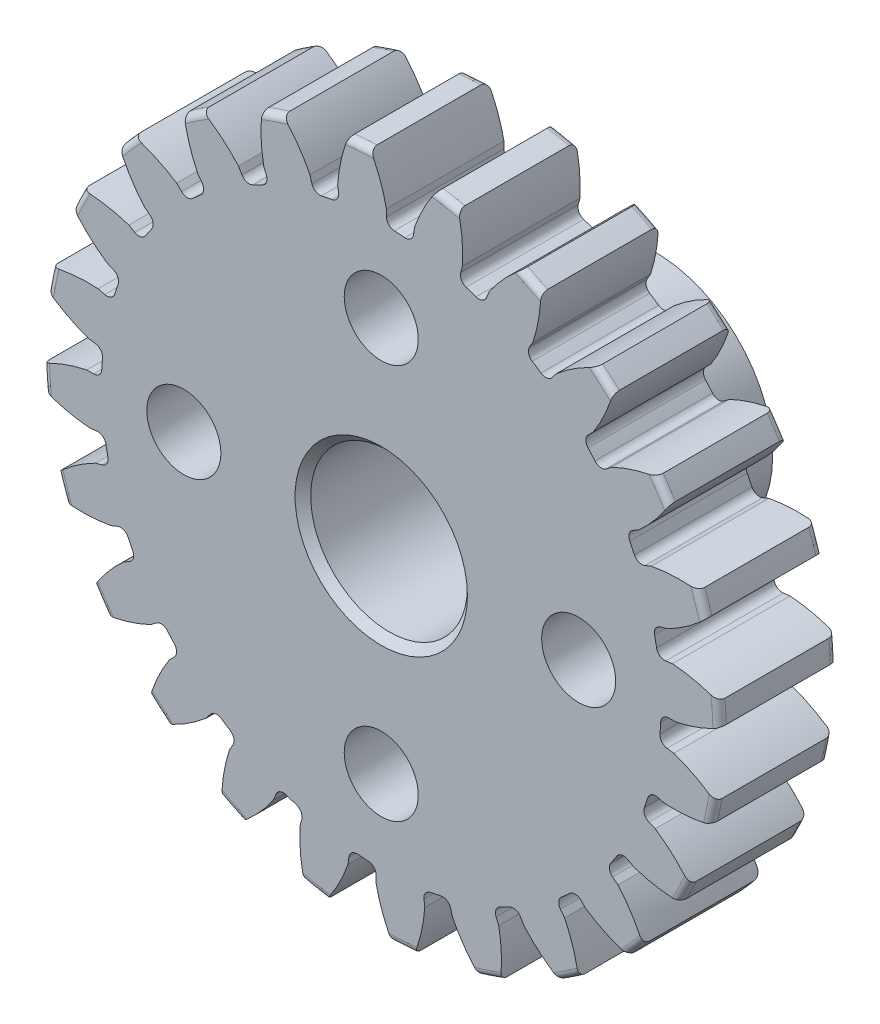
from build123d import *

# Parameters (mm, degrees)
SKETCH1_R                = 13.716
BOSS_EXTRUDE1_DEPTH      = 4.7625
SKETCH2_W                = 6.3373
SKETCH2_H                = 6.35
FILLET2_R                = 0.27432
CUT_EXTRUDE1_DEPTH       = 23.348666063
FILLET1_R                = 0.332486
CIRPATTERN1_COUNT        = 24
FILLET1_OF_CIRPATTERN1_R = 0.332486
SKETCH5_R                = 3.175
CUT_EXTRUDE2_DEPTH       = 23.339624524
CHAMFER1_SIZE            = 0.3175
SKETCH19_OUTSIDE_W       = 37.484
SKETCH19_OUTSIDE_H       = 37.484
SKETCH19_OUTSIDE_R       = 4.7625
CUT_EXTRUDE9_DEPTH       = 21.396436825
SKETCH20_R               = 1.5
CUT_EXTRUDE8_DEPTH       = 21.396436825
CHAMFER4_SIZE            = 1.5
CUT_EXTRUDE10_DEPTH      = 23.339624524
CUT_EXTRUDE10_DEPTH_BACK = 23.339624524
SKETCH21_R               = 0.9525


with BuildPart() as part:
    # Sketch1 → Boss-Extrude1 (new body)
    with BuildSketch(Plane.XY):
        Circle(SKETCH1_R)
    extrude(amount=-BOSS_EXTRUDE1_DEPTH)

    # Sketch2 → Revolve1 (revolve)
    with BuildSketch(Plane(origin=(0, 0, 0), x_dir=(0, 0, -1), z_dir=(1, 0, 0))):
        with Locations((7.93115, 3.175)):
            Rectangle(SKETCH2_W, SKETCH2_H)
    revolve(axis=Axis((0, 0, -4.7625), (0, 0, -1)))

    # Fillet2
    fillet2_edges = [part.edges().sort_by_distance(p)[0] for p in [
        (-13.716, 0, -4.7625),
        (-13.716, 0, 0),
        (0, -6.35, -4.7625),
    ]]
    fillet(fillet2_edges, radius=FILLET2_R)

    # Sketch4 → Cut-Extrude1 (cut, through all)
    with BuildSketch(Plane.XY):
        with BuildLine():
            Line((0.210191388, 11.932245124), (0.210191388, 11.33280094))
            ThreePointArc((0.210191388, 11.33280094), (0.74132985, 11.310481317), (1.27083763, 11.263282349))
            Line((1.27083763, 11.263282349), (1.349080978, 11.857598181))
            add(Edge.make_bspline(
                [(5.307200939, 15.849419331), (2.291771979, 14.546050899), (1.349080978, 11.857598181)],
                knots=[0, 0, 0, 1, 1, 1], degree=2))
            ThreePointArc((5.307200939, 15.849419331), (1.093175261, 16.67859235), (-3.193027723, 16.406555059))
            add(Edge.make_bspline(
                [(-3.193027723, 16.406555059), (-0.37352041, 14.720743801), (0.210191388, 11.932245124)],
                knots=[0, 0, 0, 1, 1, 1], degree=2))
        make_face()
    cut_extrude1 = extrude(amount=-CUT_EXTRUDE1_DEPTH, mode=Mode.SUBTRACT)

    # Fillet1
    fillet1_edges = [part.edges().sort_by_distance(p)[0] for p in [
        (1.27083763, 11.263282349, -2.38125),
        (0.210191388, 11.33280094, -2.38125),
    ]]
    fillet(fillet1_edges, radius=FILLET1_R)

    # CirPattern1: Cut-Extrude1 ×24 about axis
    cirpattern1_axis = Axis((0, 0, -4.7625), (0, 0, 1))
    for i in range(1, CIRPATTERN1_COUNT):
        add(cut_extrude1.rotate(cirpattern1_axis, i * 360 / CIRPATTERN1_COUNT), mode=Mode.SUBTRACT)

    # Fillet1 of CirPattern1
    fillet1_of_cirpattern1_edges = [part.edges().sort_by_distance(p)[0] for p in [
        (-1.687617095, 11.208412292, -2.38125),
        (-2.730115427, 11.001046646, -2.38125),
        (-4.531063503, 10.389707459, -2.38125),
        (-5.484369388, 9.919589204, -2.38125),
        (-7.065725422, 8.862961233, -2.38125),
        (-7.864872638, 8.162128151, -2.38125),
        (-9.11886983, 6.732218846, -2.38125),
        (-9.709397816, 5.848431552, -2.38125),
        (-10.550578328, 4.14268687, -2.38125),
        (-10.892243578, 3.136174008, -2.38125),
        (-11.263282349, 1.27083763, -2.38125),
        (-11.33280094, 0.210191388, -2.38125),
        (-11.208412292, -1.687617095, -2.38125),
        (-11.001046646, -2.730115427, -2.38125),
        (-10.389707459, -4.531063503, -2.38125),
        (-9.919589204, -5.484369388, -2.38125),
        (-8.862961233, -7.065725422, -2.38125),
        (-8.162128151, -7.864872638, -2.38125),
        (-6.732218846, -9.11886983, -2.38125),
        (-5.848431552, -9.709397816, -2.38125),
        (-4.14268687, -10.550578328, -2.38125),
        (-3.136174008, -10.892243578, -2.38125),
        (-1.27083763, -11.263282349, -2.38125),
        (-0.210191388, -11.33280094, -2.38125),
        (1.687617095, -11.208412292, -2.38125),
        (2.730115427, -11.001046646, -2.38125),
        (4.531063503, -10.389707459, -2.38125),
        (5.484369388, -9.919589204, -2.38125),
        (7.065725422, -8.862961233, -2.38125),
        (7.864872638, -8.162128151, -2.38125),
        (9.11886983, -6.732218846, -2.38125),
        (9.709397816, -5.848431552, -2.38125),
        (10.550578328, -4.14268687, -2.38125),
        (10.892243578, -3.136174008, -2.38125),
        (11.263282349, -1.27083763, -2.38125),
        (11.33280094, -0.210191388, -2.38125),
        (11.208412292, 1.687617095, -2.38125),
        (11.001046646, 2.730115427, -2.38125),
        (10.389707459, 4.531063503, -2.38125),
        (9.919589204, 5.484369388, -2.38125),
        (8.862961233, 7.065725422, -2.38125),
        (8.162128151, 7.864872638, -2.38125),
        (6.732218846, 9.11886983, -2.38125),
        (5.848431552, 9.709397816, -2.38125),
        (4.14268687, 10.550578328, -2.38125),
        (3.136174008, 10.892243578, -2.38125),
    ]]
    fillet(fillet1_of_cirpattern1_edges, radius=FILLET1_OF_CIRPATTERN1_R)

    # Sketch5 → Cut-Extrude2 (cut, through all)
    with BuildSketch(Plane.XY):
        Circle(SKETCH5_R)
    extrude(amount=-CUT_EXTRUDE2_DEPTH, mode=Mode.SUBTRACT)

    # Chamfer1
    chamfer1_edges = [part.edges().sort_by_distance(p)[0] for p in [
        (0, -6.35, -11.0998),
        (-3.175, 0, 0),
        (-3.175, 0, -11.0998),
    ]]
    chamfer(chamfer1_edges, length=CHAMFER1_SIZE)

    # Sketch19 outside → Cut-Extrude9 (cut, through all)
    with BuildSketch(Plane(origin=(0, 0, -4.7625), x_dir=(-1, 0, 0), z_dir=(0, 0, -1))):
        Rectangle(SKETCH19_OUTSIDE_W, SKETCH19_OUTSIDE_H)
        Circle(SKETCH19_OUTSIDE_R, mode=Mode.SUBTRACT)
    extrude(amount=CUT_EXTRUDE9_DEPTH, mode=Mode.SUBTRACT)

    # Sketch20 → Cut-Extrude8 (cut, through all)
    with BuildSketch(Plane(origin=(0, 0, -4.7625), x_dir=(-1, 0, 0), z_dir=(0, 0, -1))):
        with Locations((0, 7.99973)):
            Circle(SKETCH20_R)
        with Locations((7.99973, 0)):
            Circle(SKETCH20_R)
        with Locations((0, -7.99973)):
            Circle(SKETCH20_R)
        with Locations((-7.99973, 0)):
            Circle(SKETCH20_R)
    extrude(amount=-CUT_EXTRUDE8_DEPTH, mode=Mode.SUBTRACT)

    # Chamfer4
    chamfer4_edges = [part.edges().sort_by_distance(p)[0] for p in [
        (1.5, -7.99973, -4.7625),
        (-6.49973, 0, -4.7625),
        (1.5, 7.99973, -4.7625),
        (9.49973, 0, -4.7625),
    ]]
    chamfer(chamfer4_edges, length=CHAMFER4_SIZE)

    # Sketch21 → Cut-Extrude10 (cut, two sides: drawn at the far end of the back side and taken through both)
    with BuildSketch(Plane(origin=(0, 0, 0), x_dir=(1, 0, 0), z_dir=(0, 1, 0)).offset(-CUT_EXTRUDE10_DEPTH_BACK)):
        with Locations((0, 6.985)):
            Circle(SKETCH21_R)
    extrude(amount=CUT_EXTRUDE10_DEPTH + CUT_EXTRUDE10_DEPTH_BACK, mode=Mode.SUBTRACT)


solid = part.part
